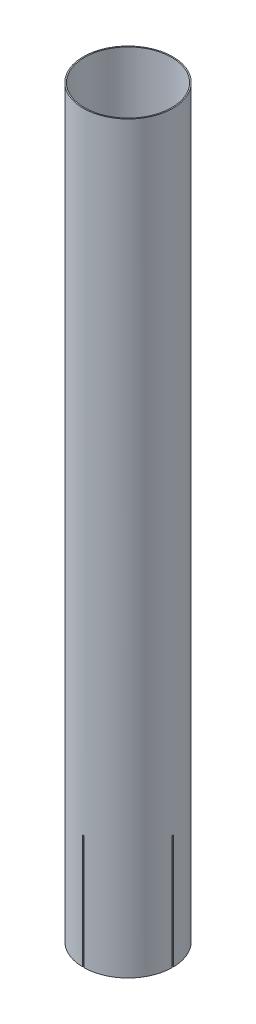
from build123d import *

# Parameters (mm, degrees)
SKETCH1_W          = 2
SKETCH1_H          = 1300
CUT_EXTRUDE1_DEPTH = 1.5
CIRPATTERN1_COUNT  = 4


with BuildPart() as part:
    # Sketch1 → Revolve1 (revolve)
    with BuildSketch(Plane.XY):
        with Locations((77.2, 650)):
            Rectangle(SKETCH1_W, SKETCH1_H)
    revolve(axis=Axis((0, 0, 0), (0, 1, 0)))

    # Sketch2 → Cut-Extrude1 (cut, symmetric)
    with BuildSketch(Plane.XY):
        Polygon((-185.2, 150), (-185.2, 0), (-78.2, 0), (0, 0), (0, 200), (-78.2, 200), align=None)
    cut_extrude1 = extrude(amount=CUT_EXTRUDE1_DEPTH, both=True, mode=Mode.SUBTRACT)

    # CirPattern1: Cut-Extrude1 ×4 about axis
    cirpattern1_axis = Axis((0, 0, 0), (0, -1, 0))
    for i in range(1, CIRPATTERN1_COUNT):
        add(cut_extrude1.rotate(cirpattern1_axis, i * 360 / CIRPATTERN1_COUNT), mode=Mode.SUBTRACT)


solid = part.part
